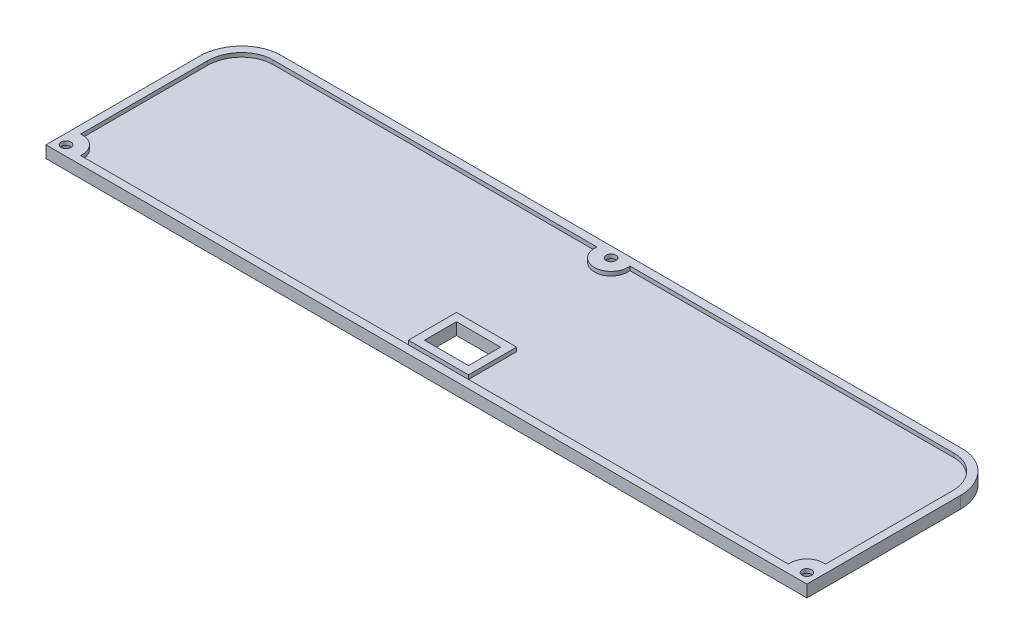
from build123d import *

# Parameters (mm, degrees)
EXTRUDE_2_DEPTH          = 3
HOLE_WIZARD_6_AT_2_COUNT = 2
HOLE_WIZARD_6_AT_2_PITCH = 102.259107828
HOLE_WIZARD_6_AT_3_COUNT = 2
HOLE_WIZARD_6_AT_3_PITCH = 185
SKETCH_15_W              = 11
SKETCH_15_H              = 8
CUT_EXTRUDE_1_DEPTH      = 99.115732766
SHELL_START              = 2
SHELL_3_OUTLINE_W        = 15
SHELL_3_OUTLINE_H        = 12
SHELL_3_DEPTH            = 1


# Read off the part's stored shape, not the designer's step: 抽壳3
with BuildPart() as part:
    # 草图1 → 凸台-拉伸2 (new body)
    with BuildSketch(Plane(origin=(0, 0, 0), x_dir=(1, 0, 0), z_dir=(0, 1, 0))):
        with BuildLine():
            Line((85, 24.345368999), (-85, 24.345368999))
            add(Edge.make_bspline(
                [(-85, 24.345368999), (-95, 24.345368999), (-95, 13.969349259)],
                knots=[0, 0, 0, 1.570796327, 1.570796327, 1.570796327], degree=2, weights=[1, 0.707106781, 1]))
            Line((-95, 13.969349259), (-95, -24.345368999))
            Line((-95, -24.345368999), (95, -24.345368999))
            Line((95, -24.345368999), (95, 13.969349259))
            add(Edge.make_bspline(
                [(95, 13.969349259), (95, 24.345368999), (85, 24.345368999)],
                knots=[1.570796327, 1.570796327, 1.570796327, 3.141592654, 3.141592654, 3.141592654], degree=2, weights=[1, 0.707106781, 1]))
        make_face()
    extrude(amount=EXTRUDE_2_DEPTH)

    # 草图14 → 大小六角凹头盖螺钉柱孔6 (revolve, cut)
    with BuildSketch(Plane(origin=(92.5, 0, 21.845368999), x_dir=(0, 0, -1), z_dir=(1, 0, 0))):
        Polygon((0, 0), (0, 3), (1.2, 3), (1.2, 2), (2.15, 2), (2.15, 0.024142219), (2.175, 0), align=None)
    hole_wizard_6 = revolve(axis=Axis((92.5, -6.35, 21.845368999), (0, 1, 0)), mode=Mode.SUBTRACT)

    # 大小六角凹头盖螺钉柱孔6 at 2: 大小六角凹头盖螺钉柱孔6 ×2
    with Locations(*[Vector(-0.9045649034602262, 0, -0.42633594198471203) * (i * HOLE_WIZARD_6_AT_2_PITCH) for i in range(1, HOLE_WIZARD_6_AT_2_COUNT)]):
        add(hole_wizard_6, mode=Mode.SUBTRACT)

    # 大小六角凹头盖螺钉柱孔6 at 3: 大小六角凹头盖螺钉柱孔6 ×2
    with Locations(*[(-i * HOLE_WIZARD_6_AT_3_PITCH, 0, 0) for i in range(1, HOLE_WIZARD_6_AT_3_COUNT)]):
        add(hole_wizard_6, mode=Mode.SUBTRACT)

    # 草图15 → 切除-拉伸1 (cut, through all)
    with BuildSketch(Plane.XZ):
        with Locations((0, 15.345368999)):
            Rectangle(SKETCH_15_W, SKETCH_15_H)
    extrude(amount=-CUT_EXTRUDE_1_DEPTH, mode=Mode.SUBTRACT)

    # 抽壳3 outline → 抽壳3 (cut)
    with BuildSketch(Plane(origin=(0, 0, 0), x_dir=(1, 0, 0), z_dir=(0, 1, 0)).offset(SHELL_START)):
        with BuildLine():
            Line((93, -17.725599588), (93.000000196, 13.969349259))
            add(Edge.make_bspline(
                [(93.000000196, 13.969349259), (93.000000196, 14.990185456), (92.871215367, 16.011021653), (92.613645709, 17.01184643), (92.230602513, 17.972648367), (91.728708361, 18.874166906), (91.117678233, 19.698643208), (90.409881727, 20.430484444), (89.619725312, 21.056754945), (88.762932516, 21.567410906), (87.855861705, 21.955201909), (86.915108734, 22.215310689), (85.957556964, 22.345368999), (85, 22.345368999)],
                knots=[1.570796327, 1.570796327, 1.570796327, 1.570796327, 1.570796327, 1.570796327, 1.570796327, 1.570796327, 1.570796327, 1.570796327, 1.570796327, 1.570796327, 1.570796327, 1.570796327, 3.141592654, 3.141592654, 3.141592654, 3.141592654, 3.141592654, 3.141592654, 3.141592654, 3.141592654, 3.141592654, 3.141592654, 3.141592654, 3.141592654, 3.141592654, 3.141592654], degree=13))
            Line((85, 22.345368999), (4.107268939, 22.345368999))
            ThreePointArc((4.107268939, 22.345368999), (0, 17.601364064), (-4.107268939, 22.345368999))
            Line((-4.107268939, 22.345368999), (-85, 22.345368999))
            add(Edge.make_bspline(
                [(-85, 22.345368999), (-85.957556964, 22.345368999), (-86.915108734, 22.215310689), (-87.855861705, 21.955201909), (-88.762932516, 21.567410906), (-89.619725312, 21.056754945), (-90.409881727, 20.430484444), (-91.117678233, 19.698643208), (-91.728708361, 18.874166906), (-92.230602513, 17.972648367), (-92.613645709, 17.01184643), (-92.871215367, 16.011021653), (-93.000000196, 14.990185456), (-93.000000196, 13.969349259)],
                knots=[0, 0, 0, 0, 0, 0, 0, 0, 0, 0, 0, 0, 0, 0, 1.570796327, 1.570796327, 1.570796327, 1.570796327, 1.570796327, 1.570796327, 1.570796327, 1.570796327, 1.570796327, 1.570796327, 1.570796327, 1.570796327, 1.570796327, 1.570796327], degree=13))
            Line((-93.000000196, 13.969349259), (-93, -17.725599588))
            ThreePointArc((-93, -17.725599588), (-89.565506858, -18.910875857), (-88.380230589, -22.345368999))
            Line((-88.380230589, -22.345368999), (88.380230589, -22.345368999))
            ThreePointArc((88.380230589, -22.345368999), (89.565506858, -18.910875857), (93, -17.725599588))
        make_face()
        with Locations((0, -15.345368999)):
            Rectangle(SHELL_3_OUTLINE_W, SHELL_3_OUTLINE_H, mode=Mode.SUBTRACT)
    extrude(amount=SHELL_3_DEPTH, mode=Mode.SUBTRACT)


solid = part.part
